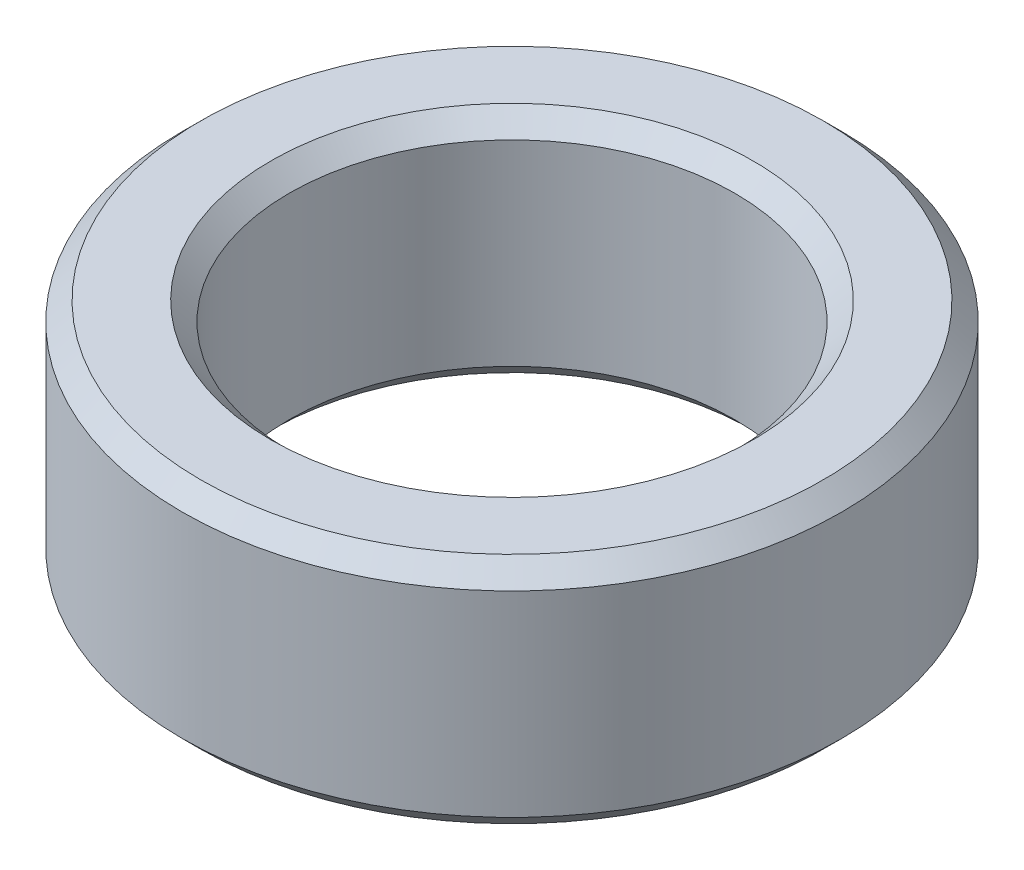
from build123d import *

# Parameters (mm, degrees)
SKETCH1_R           = 12.5
BOSS_EXTRUDE1_DEPTH = 8.843411571
SKETCH2_R           = 8.446680038
CUT_EXTRUDE1_DEPTH  = 20.76628261
CHAMFER1_SIZE       = 0.704482384


with BuildPart() as part:
    # Sketch1 → Boss-Extrude1 (new body)
    with BuildSketch(Plane(origin=(0, 0, 0), x_dir=(1, 0, 0), z_dir=(0, 1, 0))):
        Circle(SKETCH1_R)
    extrude(amount=BOSS_EXTRUDE1_DEPTH)

    # Sketch2 → Cut-Extrude1 (cut, through all)
    with BuildSketch(Plane(origin=(0, 0, 0), x_dir=(1, 0, 0), z_dir=(0, 1, 0))):
        Circle(SKETCH2_R)
    extrude(amount=CUT_EXTRUDE1_DEPTH, mode=Mode.SUBTRACT)

    # Chamfer1
    chamfer1_edges = [part.edges().sort_by_distance(p)[0] for p in [
        (-8.446680038, 8.843411571, 0),
        (-8.446680038, 0, 0),
        (-12.5, 0, 0),
        (-12.5, 8.843411571, 0),
    ]]
    chamfer(chamfer1_edges, length=CHAMFER1_SIZE)


solid = part.part
